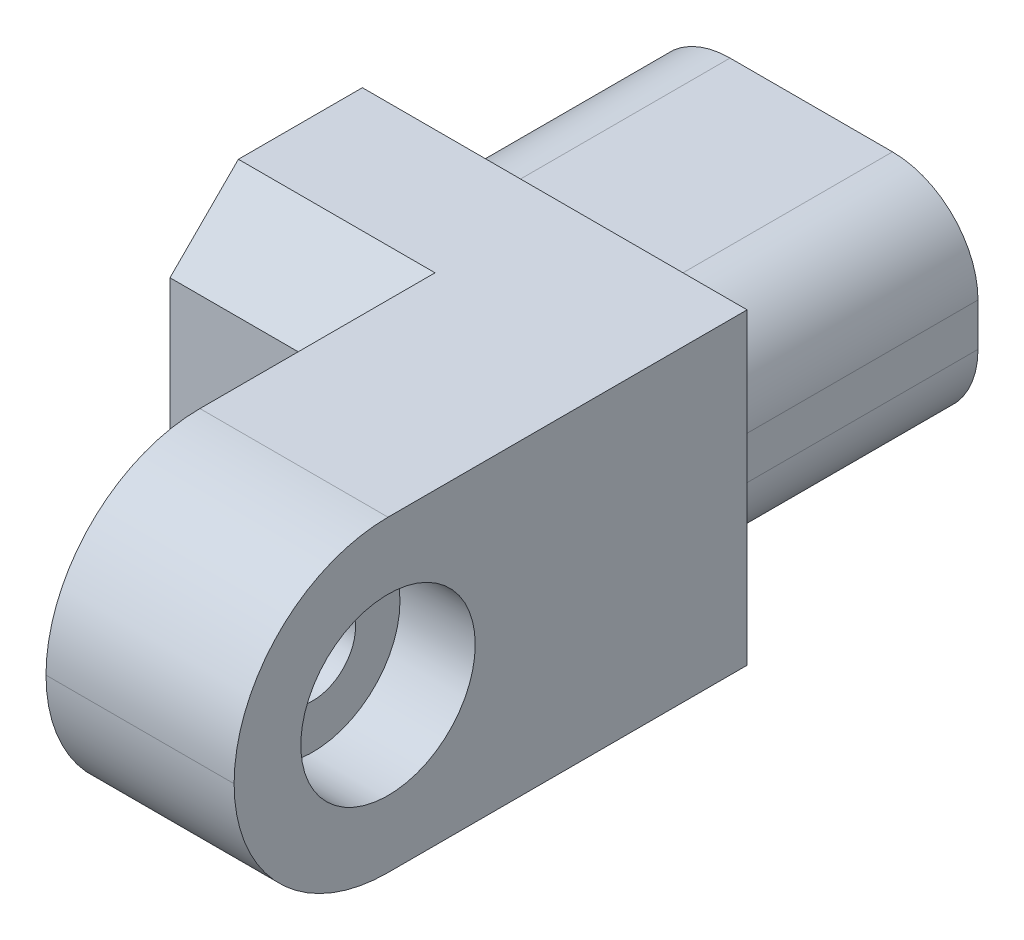
from build123d import *

# Parameters (mm, degrees)
SKETCH2_W                                            = 24.765
SKETCH2_H                                            = 15.875
BOSS_EXTRUDE1_DEPTH                                  = 19.05
SKETCH3_W                                            = 28.575
SKETCH3_H                                            = 22.86
BOSS_EXTRUDE2_DEPTH                                  = 38.1
SKETCH4_W                                            = 14.605
SKETCH4_H                                            = 23.8125
CUT_EXTRUDE1_DEPTH                                   = 47.6725
FILLET5_R                                            = 11.43
FILLET3_R                                            = 6.35
CHAMFER1_SIZE                                        = 5.08
CBORE_FOR_1_4_FILLISTER_HEAD_MACHINE_SCR_D           = 6.35
CBORE_FOR_1_4_FILLISTER_HEAD_MACHINE_SCR_CBORE_D     = 12.954
CBORE_FOR_1_4_FILLISTER_HEAD_MACHINE_SCR_CBORE_DEPTH = 5.588


with BuildPart() as part:
    # Sketch2 → Boss-Extrude1 (new body)
    with BuildSketch(Plane.XY):
        Rectangle(SKETCH2_W, SKETCH2_H)
    extrude(amount=-BOSS_EXTRUDE1_DEPTH)

    # Sketch3 → Boss-Extrude2 (add)
    with BuildSketch(Plane.XY):
        Rectangle(SKETCH3_W, SKETCH3_H)
    extrude(amount=BOSS_EXTRUDE2_DEPTH)

    # Sketch4 → Cut-Extrude1 (cut, through all)
    with BuildSketch(Plane(origin=(0, -11.43, 0), x_dir=(-1, 0, 0), z_dir=(0, -1, 0))):
        with Locations((6.985, -26.19375)):
            Rectangle(SKETCH4_W, SKETCH4_H)
    extrude(amount=-CUT_EXTRUDE1_DEPTH, mode=Mode.SUBTRACT)

    # Fillet5
    fillet5_edges = [part.edges().sort_by_distance(p)[0] for p in [
        (7.3025, -11.43, 38.1),
        (7.3025, 11.43, 38.1),
    ]]
    fillet(fillet5_edges, radius=FILLET5_R - 0.0001)  # a hair under: the kernel refuses the full size

    # Fillet3
    fillet3_edges = [part.edges().sort_by_distance(p)[0] for p in [
        (-12.3825, 7.9375, -9.525),
        (12.3825, 7.9375, -9.525),
        (12.3825, -7.9375, -9.525),
        (-12.3825, -7.9375, -9.525),
    ]]
    fillet(fillet3_edges, radius=FILLET3_R)

    # Chamfer1
    chamfer1_edges = [part.edges().sort_by_distance(p)[0] for p in [
        (-6.985, 11.43, 14.2875),
        (-6.985, -11.43, 14.2875),
    ]]
    chamfer(chamfer1_edges, length=CHAMFER1_SIZE)

    # CBORE for 1/4 Fillister Head Machine Screw1 (through all)
    with Locations(Plane(origin=(14.2875, 0, 26.67), x_dir=(0, 0, 1), z_dir=(1, 0, 0))):
        with Locations((0, 0)):
            cbore_for_1_4_fillister_head_machine_scr = CounterBoreHole(CBORE_FOR_1_4_FILLISTER_HEAD_MACHINE_SCR_D / 2, CBORE_FOR_1_4_FILLISTER_HEAD_MACHINE_SCR_CBORE_D / 2, CBORE_FOR_1_4_FILLISTER_HEAD_MACHINE_SCR_CBORE_DEPTH)

    # Mirror1: CBORE for 1/4 Fillister Head Machine Screw1 across plane
    add(cbore_for_1_4_fillister_head_machine_scr.mirror(Plane(origin=(6.985, 0, 0), x_dir=(0, 0, 1), z_dir=(1, 0, 0))), mode=Mode.SUBTRACT)


solid = part.part
